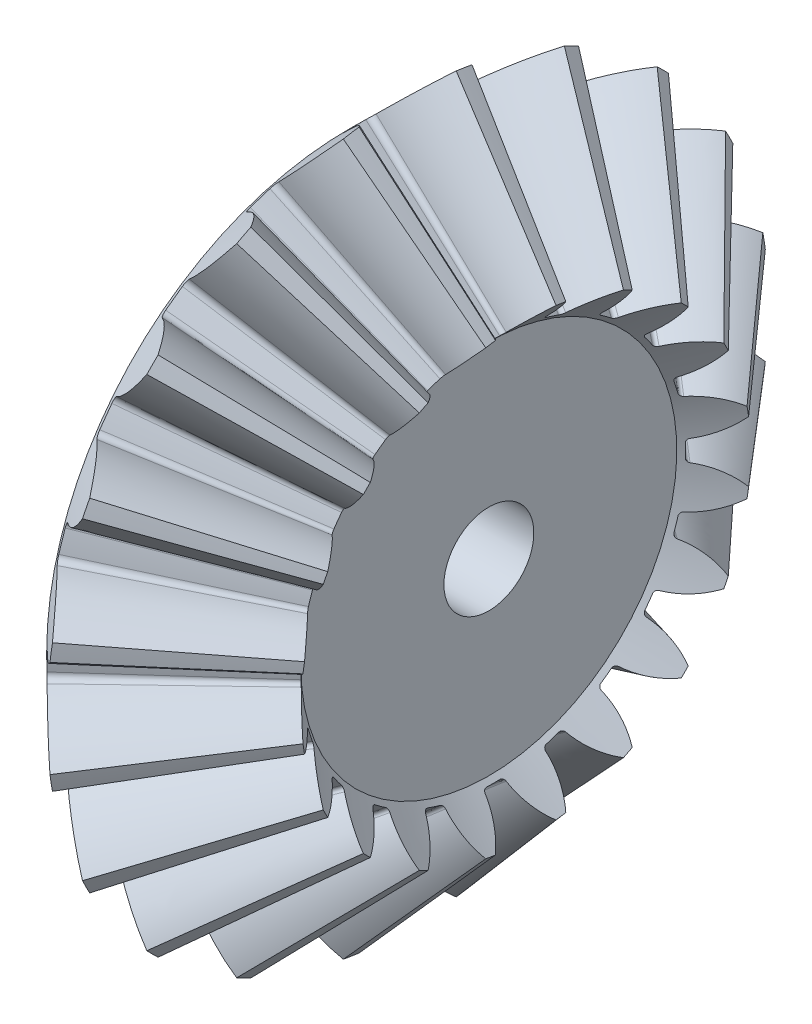
from build123d import *

# Parameters (mm, degrees)
TEETHCUTS_COUNT = 20
TEETHCUTS_ANGLE = 342
HUBSKE_R        = 6.5
HUB_DEPTH       = 3.424137361
BORSKE_R        = 2
BORE_DEPTH      = 20.0000508


with BuildPart() as part:
    # BasProSke → Base-Revolve (revolve)
    with BuildSketch(Plane(origin=(0, 0, 0), x_dir=(1, 0, 0), z_dir=(0, 1, 0)), mode=Mode.PRIVATE) as base_revolve_sk:
        Polygon((0, 0), (0, 13.424035763), (2.636624413, 16.060660171), (7.893478656, 10.003805916), (6.251187579, 8.361514842), (6.251187579, 0), align=None)
    revolve(base_revolve_sk.sketch.rotate(Axis((-10, 0, 0), (1, 0, 0)), 180), axis=Axis((-10, 0, 0), (1, 0, 0)))

    # ToothCut: read off the stored shape, not the designer's step
    # ToothCut: loft between two sections, ruled curve by curve
    toothcut_from = [
        Edge.make_bspline([(16.5820078, 0.00604356, -0.009393638), (16.577783825, 0.001819585, -0.014828786), (16.572101521, -0.003862719, -0.014024043), (16.568723522, -0.007240718, -0.007512284)], [0, 0, 0, 0, 1, 1, 1, 1], 3, [1, 0.779277714, 0.779277714, 1]),
        Edge.make_bspline([(16.568723522, -0.007240718, 0.007512284), (16.572101521, -0.003862719, 0.014024043), (16.577783825, 0.001819585, 0.014828786), (16.5820078, 0.00604356, 0.009393638)], [0, 0, 0, 0, 1, 1, 1, 1], 3, [1, 0.779277714, 0.779277714, 1]),
        Edge.make_bspline([(16.568723522, -0.007240718, -0.007512284), (16.568222968, -0.007741272, -0.006547366), (16.567823176, -0.008141064, -0.005492611), (16.567532069, -0.008432171, -0.004368917)], [0, 0, 0, 0, 1, 1, 1, 1], 3, [1, 0.993395334, 0.993395334, 1]),
        Edge.make_bspline([(16.567532069, -0.008432171, 0.004368917), (16.567823176, -0.008141064, 0.005492611), (16.568222968, -0.007741272, 0.006547366), (16.568723522, -0.007240718, 0.007512284)], [0, 0, 0, 0, 1, 1, 1, 1], 3, [1, 0.993395334, 0.993395334, 1]),
        Edge.make_bspline([(16.567532069, -0.008432171, -0.004368917), (16.566793522, -0.009170718, -0.001518075), (16.566793522, -0.009170718, 0.001518075), (16.567532069, -0.008432171, 0.004368917)], [0, 0, 0, 0, 1, 1, 1, 1], 3, [1, 0.959310846, 0.959310846, 1]),
        Edge.make_line((16.5820078, 0.00604356, 0.009393638), (16.5820078, 0.00604356, -0.009393638)),
    ]
    toothcut_to = [
        Edge.make_bspline([(2.74733297, 16.171368728, -2.409922051), (2.123976204, 15.548011963, -1.531817367), (1.34245368, 14.76648944, -0.960275378), (0.47546188, 13.899497642, -0.748460377)], [0, 0, 0, 0, 1, 1, 1, 1], 3, [1, 0.968993651, 0.968993651, 1]),
        Edge.make_bspline([(0.47546188, 13.899497642, 0.748460377), (1.34245368, 14.76648944, 0.960275378), (2.123976204, 15.548011963, 1.531817367), (2.74733297, 16.171368728, 2.409922051)], [0, 0, 0, 0, 1, 1, 1, 1], 3, [1, 0.968993651, 0.968993651, 1]),
        Edge.make_bspline([(0.47546188, 13.899497642, -0.748460377), (0.3720661, 13.796101863, -0.723199726), (0.305887237, 13.729922999, -0.608046824), (0.309537083, 13.733572845, -0.45974702)], [0, 0, 0, 0, 1, 1, 1, 1], 3, [1, 0.835739127, 0.835739127, 1]),
        Edge.make_bspline([(0.309537083, 13.733572845, 0.45974702), (0.305887237, 13.729922999, 0.608046824), (0.3720661, 13.796101863, 0.723199726), (0.47546188, 13.899497642, 0.748460377)], [0, 0, 0, 0, 1, 1, 1, 1], 3, [1, 0.835739127, 0.835739127, 1]),
        Edge.make_bspline([(0.309537083, 13.733572845, -0.45974702), (0.317078864, 13.741114626, -0.153310859), (0.317078864, 13.741114626, 0.153310859), (0.309537083, 13.733572845, 0.45974702)], [0, 0, 0, 0, 1, 1, 1, 1], 3, [1, 0.999596557, 0.999596557, 1]),
        Edge.make_line((2.74733297, 16.171368728, 2.409922051), (2.74733297, 16.171368728, -2.409922051)),
    ]
    toothcut = Solid(Shell([*[Face.make_surface_from_curves(toothcut_from[k], toothcut_to[k]) for k in range(6)], Face(Wire(toothcut_from)), Face(Wire(toothcut_to))]))
    add(toothcut, mode=Mode.SUBTRACT)

    # TeethCuts: ToothCut ×20 about axis
    teethcuts_axis = Axis((-10, 0, 0), (1, 0, 0))
    for i in range(1, TEETHCUTS_COUNT):
        add(toothcut.rotate(teethcuts_axis, i * TEETHCUTS_ANGLE / (TEETHCUTS_COUNT - 1)), mode=Mode.SUBTRACT)

    # HubSke → Hub (add)
    with BuildSketch(Plane.ZY):
        with Locations(Location((0, 0, 0), (0, 0, 180))):
            Circle(HUBSKE_R)
    extrude(amount=HUB_DEPTH)

    # BorSke → Bore (cut, symmetric)
    with BuildSketch(Plane(origin=(0, 0, 0), x_dir=(0, 0, -1), z_dir=(1, 0, 0))):
        with Locations(Location((0, 0, 0), (0, 0, 180))):
            Circle(BORSKE_R)
    extrude(amount=BORE_DEPTH, both=True, mode=Mode.SUBTRACT)


solid = part.part
